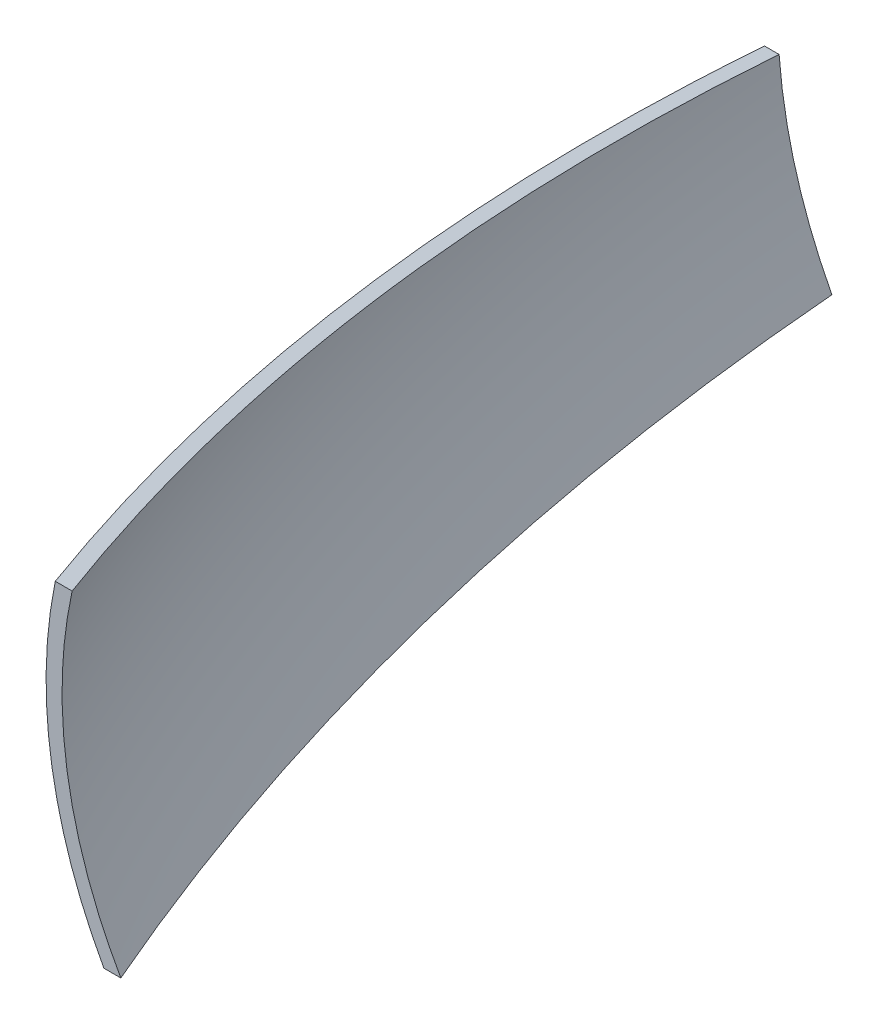
from build123d import *

# Parameters (mm, degrees)
REVOLVE1_ANGLE          = 88
CUT_EXTRUDE2_DEPTH      = 2761.625263406
CUT_EXTRUDE2_DEPTH_BACK = 2761.625263406
SKETCH5_W               = 5800.528681758
SKETCH5_H               = 2435.889164845


with BuildPart() as part:
    # Sketch2 → Revolve1 (revolve)
    with BuildSketch(Plane.XY):
        with BuildLine():
            Line((72.370392529, 0), (82.370392529, 0))
            ThreePointArc((82.370392529, 0), (50.648230739, 97.505730121), (53.578690935, 200))
            Line((53.578690935, 200), (43.578690935, 200))
            ThreePointArc((43.578690935, 200), (41.30118742, 97.59972879), (72.370392529, 0))
        make_face()
    revolve(axis=Axis((2000, -13.371705106, 0), (0, 1, 0)), revolution_arc=REVOLVE1_ANGLE)

    # Sketch5 → Cut-Extrude2 (cut, two sides: drawn at the far end of the back side and taken through both)
    with BuildSketch(Plane(origin=(0, 0, 0), x_dir=(0, 0, -1), z_dir=(1, 0, 0)).offset(-CUT_EXTRUDE2_DEPTH_BACK)):
        with Locations((76.037885341, -87.116535175)):
            Rectangle(SKETCH5_W, SKETCH5_H)
        Polygon((-762.459239957, 200), (-762.459239957, 0), (-152.859239957, 0), (-152.859239957, 116.951158177), align=None, mode=Mode.SUBTRACT)
    extrude(amount=CUT_EXTRUDE2_DEPTH + CUT_EXTRUDE2_DEPTH_BACK, mode=Mode.SUBTRACT)


solid = part.part
